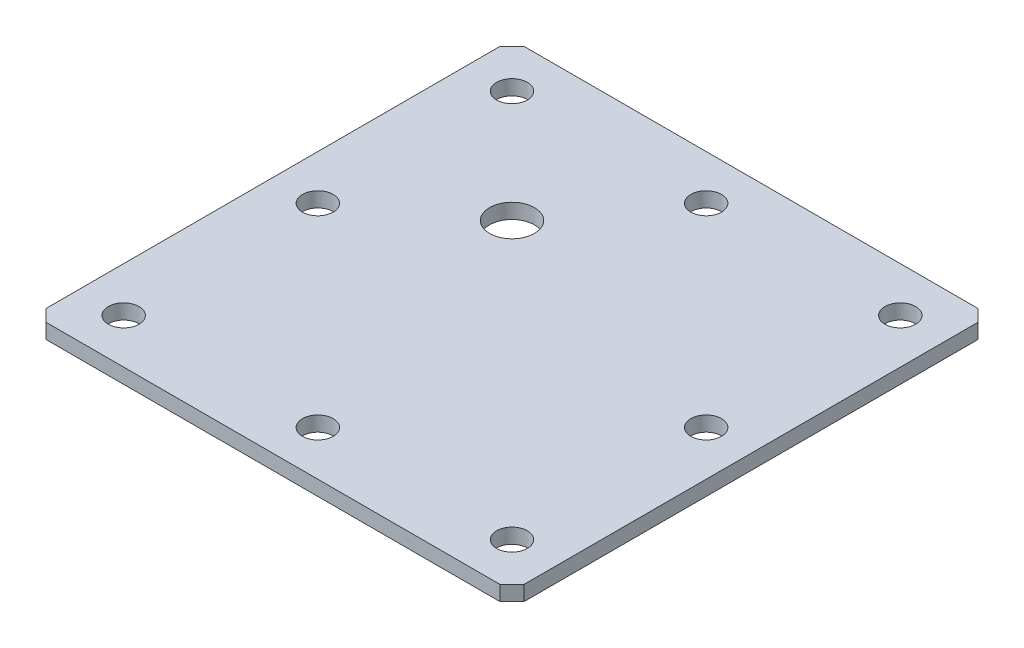
from build123d import *

# Parameters (mm, degrees)
SKETCH1_R           = 3.2639
SKETCH1_R_2         = 4.7625
BOSS_EXTRUDE1_DEPTH = 3.175


with BuildPart() as part:
    # Sketch1 → Boss-Extrude1 (new body)
    with BuildSketch(Plane(origin=(0, 0, 0), x_dir=(1, 0, 0), z_dir=(0, 1, 0))):
        Polygon((-46.888015275, 51.174177652), (-49.428015275, 48.634177652), (-49.428015275, -47.885822348), (-46.888015275, -50.425822348), (49.631984725, -50.425822348), (52.171984725, -47.885822348), (52.171984725, 48.634177652), (49.631984725, 51.174177652), align=None)
        with Locations((-39.903015275, -40.900822348)):
            Circle(SKETCH1_R, mode=Mode.SUBTRACT)
        with Locations((1.371984725, -40.900822348)):
            Circle(SKETCH1_R, mode=Mode.SUBTRACT)
        with Locations((-39.903015275, 0.374177652)):
            Circle(SKETCH1_R, mode=Mode.SUBTRACT)
        with Locations((42.646984725, -40.900822348)):
            Circle(SKETCH1_R, mode=Mode.SUBTRACT)
        with Locations((-39.903015275, 41.649177652)):
            Circle(SKETCH1_R, mode=Mode.SUBTRACT)
        with Locations((1.371984725, 41.649177652)):
            Circle(SKETCH1_R, mode=Mode.SUBTRACT)
        with Locations((42.646984725, 0.374177652)):
            Circle(SKETCH1_R, mode=Mode.SUBTRACT)
        with Locations((42.646984725, 41.649177652)):
            Circle(SKETCH1_R, mode=Mode.SUBTRACT)
        with Locations((-16.090515275, 17.836677652)):
            Circle(SKETCH1_R_2, mode=Mode.SUBTRACT)
    extrude(amount=BOSS_EXTRUDE1_DEPTH)


solid = part.part
